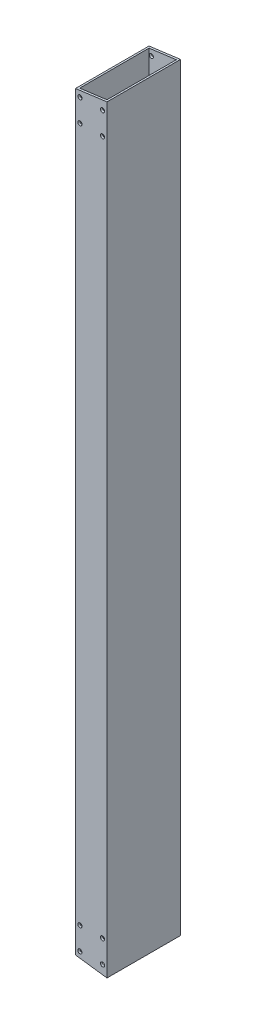
from build123d import *

# Parameters (mm, degrees)
SKETCH_1_W          = 30
SKETCH_1_H          = 750
EXTRUDE_2_DEPTH     = 70
SKETCH_2_W          = 26
SKETCH_2_H          = 66
CUT_EXTRUDE_3_DEPTH = 754.408919512
CUT_EXTRUDE_4_DEPTH = 382.772183376
SKETCH_8_R          = 2
CUT_EXTRUDE_6_DEPTH = 382.772183376


with BuildPart() as part:
    # 草图1 → 凸台-拉伸2 (new body)
    with BuildSketch(Plane.XY):
        Rectangle(SKETCH_1_W, SKETCH_1_H)
    extrude(amount=EXTRUDE_2_DEPTH)

    # 草图2 → 切除-拉伸3 (cut, through all)
    with BuildSketch(Plane.XZ.offset(375)):
        with Locations((0, 35)):
            Rectangle(SKETCH_2_W, SKETCH_2_H)
    extrude(amount=-CUT_EXTRUDE_3_DEPTH, mode=Mode.SUBTRACT)

    # 草图3 → 切除-拉伸4 (cut, through all)
    with BuildSketch(Plane.XY.offset(70)):
        Polygon((-15, 371.050425072), (15, 375), (15, 377.040830045), (-15, 377.040830045), align=None)
        Polygon((15, -375), (15, -347.1), (-15, -343.150425072), (-15, -375), align=None)
    extrude(amount=-CUT_EXTRUDE_4_DEPTH, mode=Mode.SUBTRACT)

    # 草图8 → 切除-拉伸6 (cut, through all)
    with BuildSketch(Plane(origin=(0, 0, 0), x_dir=(-1, 0, 0), z_dir=(0, 0, -1))):
        with Locations((-10.752728605, -316.565073143)):
            Circle(SKETCH_8_R)
        with Locations((10.752728605, -338.070530352)):
            Circle(SKETCH_8_R)
        with Locations((10.752728605, -316.565073143)):
            Circle(SKETCH_8_R)
        with Locations((-10.752728605, -338.070530352)):
            Circle(SKETCH_8_R)
        with Locations((-10.752728605, 365.970530352)):
            Circle(SKETCH_8_R)
        with Locations((-10.752728605, 344.465073143)):
            Circle(SKETCH_8_R)
        with Locations((10.752728605, 344.465073143)):
            Circle(SKETCH_8_R)
        with Locations((10.752728605, 365.970530352)):
            Circle(SKETCH_8_R)
    extrude(amount=-CUT_EXTRUDE_6_DEPTH, mode=Mode.SUBTRACT)


solid = part.part
